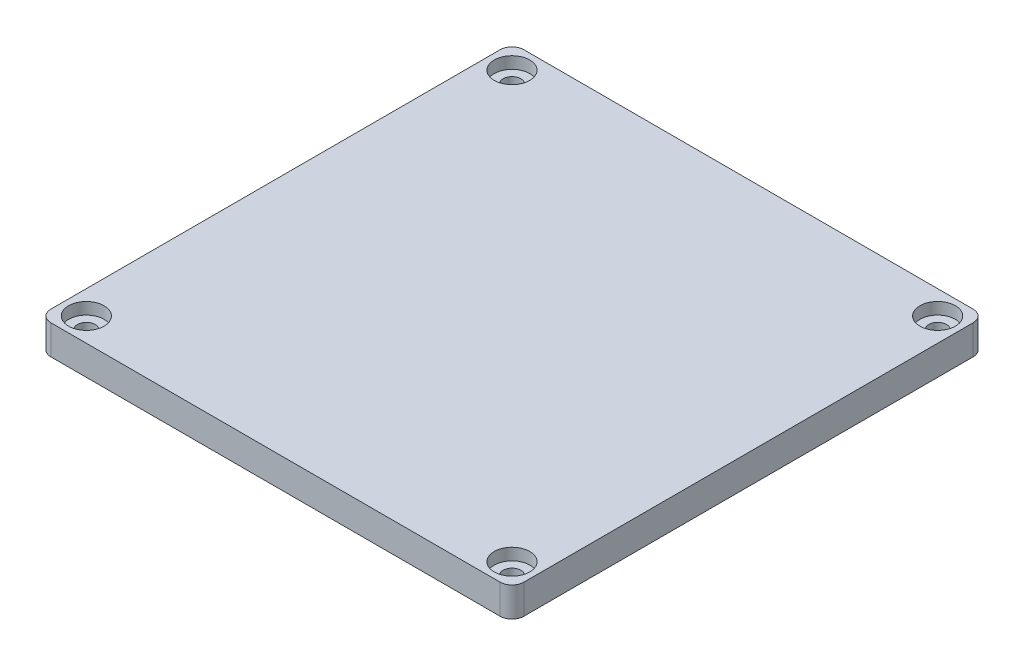
from build123d import *

# Parameters (mm, degrees)
ESQUISSE1_W             = 80
ESQUISSE1_H             = 80
ESQUISSE1_R             = 1.5
EXTRUSION1_DEPTH        = 5
CONG_1_R                = 2
ESQUISSE3_R             = 3
ENL_V_MAT_EXTRU_2_DEPTH = 2


with BuildPart() as part:
    # Esquisse1 → Extrusion1 (new body)
    with BuildSketch(Plane(origin=(0, 0, 0), x_dir=(1, 0, 0), z_dir=(0, 1, 0))):
        Rectangle(ESQUISSE1_W, ESQUISSE1_H)
        with Locations((-36, 36)):
            Circle(ESQUISSE1_R, mode=Mode.SUBTRACT)
        with Locations((36, 36)):
            Circle(ESQUISSE1_R, mode=Mode.SUBTRACT)
        with Locations((-36, -36)):
            Circle(ESQUISSE1_R, mode=Mode.SUBTRACT)
        with Locations((36, -36)):
            Circle(ESQUISSE1_R, mode=Mode.SUBTRACT)
    extrude(amount=EXTRUSION1_DEPTH)

    # Congé1
    cong_1_edges = [part.edges().sort_by_distance(p)[0] for p in [
        (40, 2.5, -40),
        (-40, 2.5, -40),
        (-40, 2.5, 40),
        (40, 2.5, 40),
    ]]
    fillet(cong_1_edges, radius=CONG_1_R)

    # Esquisse3 → Enlèv. mat.-Extru.2 (cut)
    with BuildSketch(Plane(origin=(0, 5, 0), x_dir=(1, 0, 0), z_dir=(0, 1, 0))):
        with Locations((-36, -36)):
            Circle(ESQUISSE3_R)
        with Locations((36, -36)):
            Circle(ESQUISSE3_R)
        with Locations((36, 36)):
            Circle(ESQUISSE3_R)
        with Locations((-36, 36)):
            Circle(ESQUISSE3_R)
    extrude(amount=-ENL_V_MAT_EXTRU_2_DEPTH, mode=Mode.SUBTRACT)


solid = part.part
